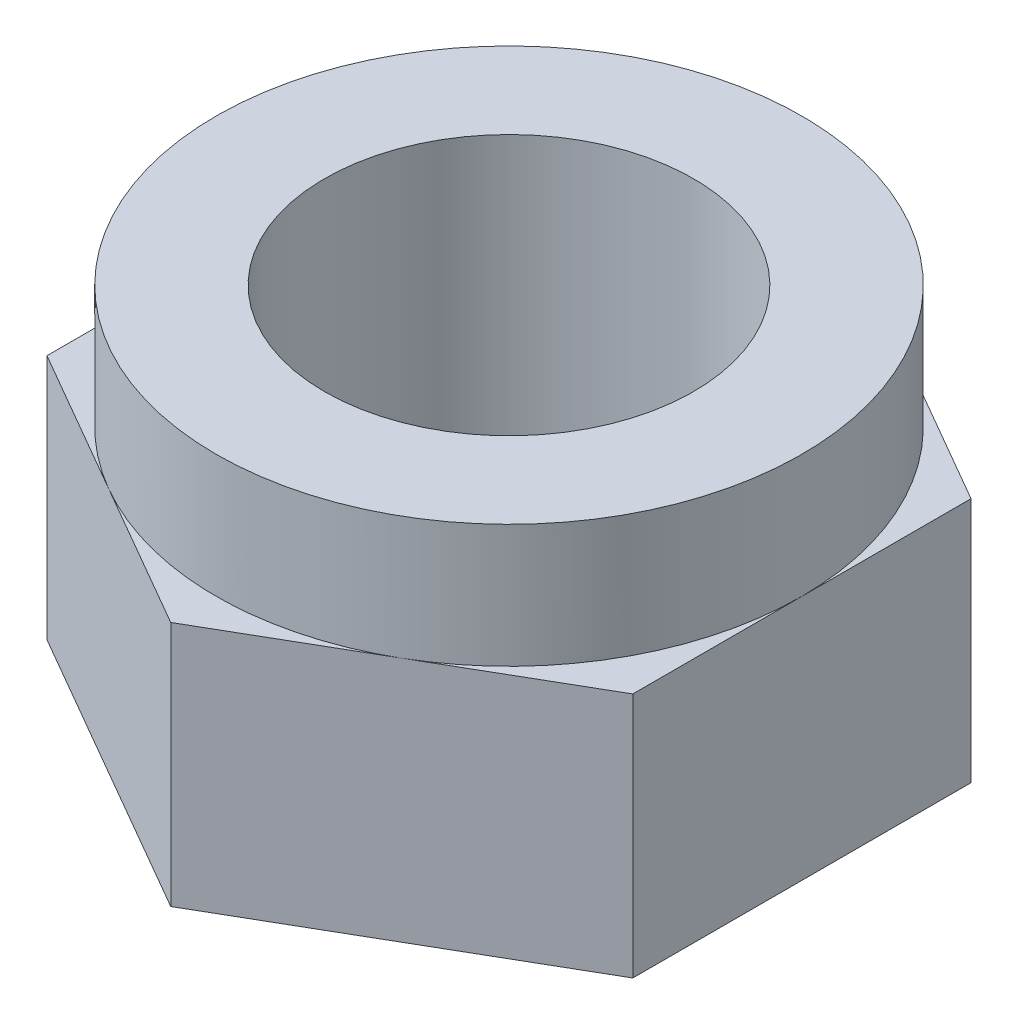
from build123d import *

# Parameters (mm, degrees)
SKETCH1_R           = 3
BOSS_EXTRUDE1_DEPTH = 4
SKETCH2_R           = 4.763139721
SKETCH2_R_2         = 3
BOSS_EXTRUDE2_DEPTH = 2


with BuildPart() as part:
    # Sketch1 → Boss-Extrude1 (new body)
    with BuildSketch(Plane(origin=(0, 0, 0), x_dir=(1, 0, 0), z_dir=(0, 1, 0))):
        Polygon((0, 5.5), (-4.763139721, 2.75), (-4.763139721, -2.75), (0, -5.5), (4.763139721, -2.75), (4.763139721, 2.75), align=None)
        Circle(SKETCH1_R, mode=Mode.SUBTRACT)
    extrude(amount=BOSS_EXTRUDE1_DEPTH)

    # Sketch2 → Boss-Extrude2 (add)
    with BuildSketch(Plane(origin=(0, 4, 0), x_dir=(1, 0, 0), z_dir=(0, 1, 0))):
        Circle(SKETCH2_R)
        Circle(SKETCH2_R_2, mode=Mode.SUBTRACT)
    extrude(amount=BOSS_EXTRUDE2_DEPTH)


solid = part.part
